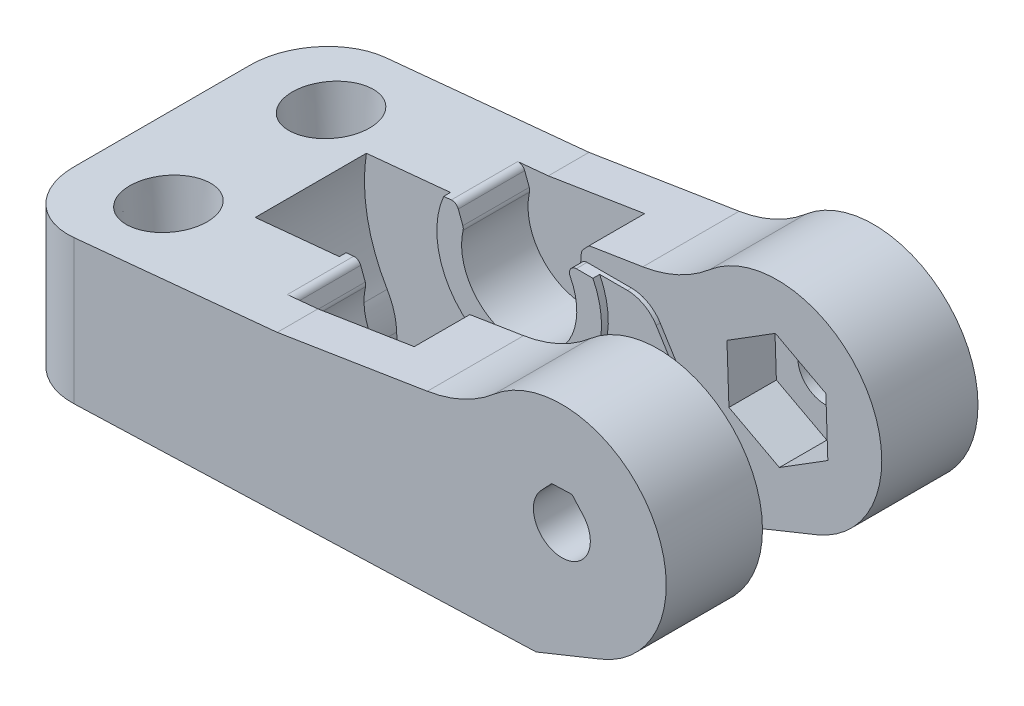
from build123d import *
from build123d.topology import SkipClean

# Parameters (mm, degrees)
SALIENTE_EXTRUIR1_DEPTH         = 23
CORTAR_EXTRUIR1_DEPTH           = 4.4
CROQUIS4_R                      = 2.1
CORTAR_EXTRUIR3_DEPTH           = 49.155331227
CORTAR_EXTRUIR11_DEPTH          = 49.155331227
CROQUIS5_R                      = 11.915
CORTAR_EXTRUIR4_DEPTH           = 4.1
SALIENTE_EXTRUIR2_DEPTH         = 0.5
CROQUIS7_R                      = 4.25
CORTAR_EXTRUIR5_DEPTH           = 6.25
CORTAR_EXTRUIR7_DEPTH           = 3.5
CROQUIS10_R                     = 2.25
CORTAR_EXTRUIR8_DEPTH           = 53.746474455
CORTAR_EXTRUIR8_DRAFT           = -3
CORTAR_EXTRUIR8_PROFILE_2_DEPTH = 53.746474455
CORTAR_EXTRUIR8_PROFILE_2_DRAFT = -3
REDONDEO1_R                     = 5
REDONDEO2_R                     = 2.5
REDONDEO7_R                     = 5
REDONDEO11_R                    = 1
CORTAR_EXTRUIR13_DEPTH          = 8.8
REDONDEO12_R                    = 3
CORTAR_EXTRUIR14_DEPTH          = 8.2
REDONDEO13_R                    = 5
MOVER_CARA1_BY                  = 0.1
MOVER_CARA1_2_BY                = 0.1
MOVER_CARA1_3_BY                = 0.1
MOVER_CARA1_4_BY                = 0.1
CORTAR_EXTRUIR16_DEPTH          = 8.5
CORTAR_EXTRUIR21_DEPTH          = 49.155331227
REDONDEO18_R                    = 3
CORTAR_EXTRUIR24_DEPTH          = 49.155331227
SALIENTE_EXTRUIR10_DEPTH        = 7.1
CROQUIS40_W                     = 6.032148686
CROQUIS40_H                     = 4.1
CORTAR_EXTRUIR25_DEPTH          = 10
REDONDEO21_R                    = 10
CORTAR_EXTRUIR27_DEPTH          = 4.9
CORTAR_EXTRUIR28_DEPTH          = 0.8
CORTAR_EXTRUIR29_DEPTH          = 4.1
REDONDEO21_OF_SIMETR_A4_R       = 10
REDONDEO22_R                    = 0.5
REDONDEO23_R                    = 0.5


with BuildPart() as part:
    # Croquis1 → Saliente-Extruir1 (new body)
    with BuildSketch(Plane.XY):
        with BuildLine():
            Line((1.026246547, -8.96964858), (-41, -10.437237448))
            Line((-41, -10.437237448), (-41, 1.8))
            Line((-41, 1.8), (-7.486654794, 1.8))
            ThreePointArc((-7.486654794, 1.8), (4.166571915, 6.475313002), (4.74059336, -6.067682803))
            Line((4.74059336, -6.067682803), (1.026246547, -8.96964858))
        make_face()
    extrude(amount=SALIENTE_EXTRUIR1_DEPTH)

    # Croquis2 → Cortar-Extruir1 (cut, symmetric)
    with BuildSketch(Plane.XY.offset(11.5)):
        with BuildLine():
            Line((-5.936336673, -3.70943485), (-9.720717172, 2.346839933))
            ThreePointArc((-9.720717172, 2.346839933), (7.132504492, 7.009092643), (2.176832591, -9.760194664))
            Line((2.176832591, -9.760194664), (-3.812473245, -5.870693976))
            ThreePointArc((-3.812473245, -5.870693976), (-4.992753144, -4.90636485), (-5.936336673, -3.70943485))
        make_face()
    extrude(amount=CORTAR_EXTRUIR1_DEPTH, both=True, mode=Mode.SUBTRACT)

    # Croquis4 → Cortar-Extruir3 (cut, through all)
    with BuildSketch(Plane.XY.offset(23)):
        Circle(CROQUIS4_R)
    extrude(amount=-CORTAR_EXTRUIR3_DEPTH, mode=Mode.SUBTRACT)

    # Croquis15 → Cortar-Extruir11 (cut, through all)
    with BuildSketch(Plane.XY.offset(23)):
        with BuildLine():
            Line((-1.526902065, 1.441724691), (-0.74954312, 2.265010153))
            Line((-0.74954312, 2.265010153), (0.74954312, 2.317359398))
            Line((0.74954312, 2.317359398), (1.569316776, 1.395437156))
            ThreePointArc((1.569316776, 1.395437156), (0.031390857, 2.099765371), (-1.526902065, 1.441724691))
        make_face()
    extrude(amount=-CORTAR_EXTRUIR11_DEPTH, mode=Mode.SUBTRACT)

    # Croquis5 → Cortar-Extruir4 (cut, symmetric)
    with BuildSketch(Plane.XY.offset(11.5)):
        with Locations((-18.25, -0.9)):
            Circle(CROQUIS5_R)
    extrude(amount=CORTAR_EXTRUIR4_DEPTH, both=True, mode=Mode.SUBTRACT)

    # Croquis6 → Saliente-Extruir2 (add)
    with BuildSketch(Plane(origin=(0, 0, 15.6), x_dir=(-1, 0, 0), z_dir=(0, 0, -1))):
        with BuildLine():
            Line((12.80797602, 1.8), (14.967851314, 1.8))
            ThreePointArc((14.967851314, 1.8), (18.25, -5.15), (21.532148686, 1.8))
            Line((21.532148686, 1.8), (23.69202398, 1.8))
            ThreePointArc((23.69202398, 1.8), (18.25, -6.975), (12.80797602, 1.8))
        make_face()
    saliente_extruir2 = extrude(amount=SALIENTE_EXTRUIR2_DEPTH)

    # Croquis7 → Cortar-Extruir5 (cut, symmetric)
    with SkipClean():  # the faces are left unmerged after this step: merging them gives an invalid solid
        with BuildSketch(Plane(origin=(0, 0, 11.5), x_dir=(-1, 0, 0), z_dir=(0, 0, -1))):
            with Locations((18.25, -0.9)):
                Circle(CROQUIS7_R)
        cortar_extruir5 = extrude(amount=CORTAR_EXTRUIR5_DEPTH, both=True, mode=Mode.SUBTRACT)
    add(part.part.scale(1), mode=Mode.REPLACE)  # the faces are merged on a copy

    # Croquis9 → Cortar-Extruir7 (cut)
    with BuildSketch(Plane(origin=(0, 0, 15.9), x_dir=(-1, 0, 0), z_dir=(0, 0, -1))):
        Polygon((-3.574231815, 2.233427918), (-3.721321222, -1.978661592), (-0.147089407, -4.21208951), (3.574231815, -2.233427918), (3.721321222, 1.978661592), (0.147089407, 4.21208951), align=None)
    cortar_extruir7 = extrude(amount=-CORTAR_EXTRUIR7_DEPTH, mode=Mode.SUBTRACT)

    # Simetría2: Saliente-Extruir2, Cortar-Extruir5, Cortar-Extruir7 across plane
    with SkipClean():  # the faces are left unmerged after this step: merging them gives an invalid solid
        add(saliente_extruir2.mirror(Plane.XY.offset(11.5)))
        add(cortar_extruir5.mirror(Plane.XY.offset(11.5)), mode=Mode.SUBTRACT)
        add(cortar_extruir7.mirror(Plane.XY.offset(11.5)), mode=Mode.SUBTRACT)
    add(part.part.scale(1), mode=Mode.REPLACE)  # the faces are merged on a copy


with BuildPart() as cortar_extruir8_tool:
    # Croquis10 → Cortar-Extruir8 (with draft: the straight prism first)
    with BuildSketch(Plane(origin=(1.359936523, -9.958605413, -3), x_dir=(-0.999390827019096, -0.034899496702497465, 0), z_dir=(-0.034899496702497465, 0.999390827019096, 0))):
        with Locations((35.51155777, 8.5)):
            Circle(CROQUIS10_R)
    extrude(amount=CORTAR_EXTRUIR8_DEPTH)
    # Cortar-Extruir8: the draft: its side faces are tilted about the plane it starts from
    cortar_extruir8_sides = [cortar_extruir8_tool.faces().sort_by_distance(p)[0] for p in [
        (-32.819221658, 15.737449738, 5.5),
    ]]
    draft(cortar_extruir8_sides, Plane(origin=(1.359936523, -9.958605413, -3), x_dir=(-0.999390827019096, -0.034899496702497465, 0), z_dir=(-0.034899496702497465, 0.999390827019096, 0)), CORTAR_EXTRUIR8_DRAFT)


with BuildPart() as part_1:
    add(part.part)

    # Cortar-Extruir8: cut by cortar_extruir8_tool
    add(cortar_extruir8_tool.part, mode=Mode.SUBTRACT)


with BuildPart() as cortar_extruir8_profile_2_tool:
    # Croquis10 → Cortar-Extruir8 profile 2 (with draft: the straight prism first)
    with BuildSketch(Plane(origin=(1.359936523, -9.958605413, -3), x_dir=(-0.999390827019096, -0.034899496702497465, 0), z_dir=(-0.034899496702497465, 0.999390827019096, 0))):
        with Locations((35.51155777, 20.5)):
            Circle(CROQUIS10_R)
    extrude(amount=CORTAR_EXTRUIR8_PROFILE_2_DEPTH)
    # Cortar-Extruir8 profile 2: the draft: its side faces are tilted about the plane it starts from
    cortar_extruir8_profile_2_sides = [cortar_extruir8_profile_2_tool.faces().sort_by_distance(p)[0] for p in [
        (-32.819221658, 15.737449738, 17.5),
    ]]
    draft(cortar_extruir8_profile_2_sides, Plane(origin=(1.359936523, -9.958605413, -3), x_dir=(-0.999390827019096, -0.034899496702497465, 0), z_dir=(-0.034899496702497465, 0.999390827019096, 0)), CORTAR_EXTRUIR8_PROFILE_2_DRAFT)


with BuildPart() as part_2:
    add(part_1.part)

    # Cortar-Extruir8 profile 2: cut by cortar_extruir8_profile_2_tool
    add(cortar_extruir8_profile_2_tool.part, mode=Mode.SUBTRACT)

    # Redondeo1
    redondeo1_edges = [part_2.edges().sort_by_distance(p)[0] for p in [
        (-7.486654794, 1.8, 3.55),
        (-7.486654794, 1.8, 19.45),
    ]]
    fillet(redondeo1_edges, radius=REDONDEO1_R)

    # Redondeo2
    # the kernel refuses this fillet: 2.5 mm, written as the material it takes off along each edge
    with BuildSketch(Plane(origin=(-9.477934737, 1.95830682, 11.66888847), x_dir=(-0.9925180140171804, -0.12209828766773127, 0), z_dir=(0, 0, 1)), Plane(origin=(-9.477934737, 1.95830682, 7.1), x_dir=(-0.9925180140171804, -0.12209828766773127, 0), z_dir=(0, 0, 1))) as redondeo2_piece_1:
        with BuildLine():
            CenterArc((1.601798054, 2.481295035), REDONDEO2_R, 204.986783762, 58)
            Line((-0.664215063, 1.425272047), (-0.890816375, 1.319669748))
            Line((-0.890816375, 1.319669748), (-0.226601312, -0.105602299))
            Line((-0.226601312, -0.105602299), (0.032385005, -0.247893549))
            ThreePointArc((0.032385005, -0.247893549), (1.22766696, -0.243410407), (1.266027763, -0.248129504))
            Line((1.266027763, -0.248129504), (1.296552335, 0))
        make_face()
    extrude(amount=4.23111153, mode=Mode.SUBTRACT)

    # Redondeo7
    redondeo7_edges = [part_2.edges().sort_by_distance(p)[0] for p in [
        (-41, -4.318618724, 23),
        (-41, -4.318618724, 0),
    ]]
    fillet(redondeo7_edges, radius=REDONDEO7_R)

    # Redondeo11
    # the kernel refuses this fillet: 1 mm, written as the material it takes off along each edge
    with BuildSketch(Plane(origin=(-6.491004214, -2.821781232, 7.4), x_dir=(-0.24834471641059566, -0.9686717203629621, 0), z_dir=(0, 0, 1))) as redondeo11_piece_1:
        with BuildLine():
            CenterArc((2.206273853, 0.996044557), REDONDEO11_R, 144.980572928, 119.921677826)
            Line((1.387316336, 1.569898707), (1.305420584, 1.627284122))
            ThreePointArc((1.305420584, 1.627284122), (0.649703597, 0.826722603), (-0.072392607, 0.068987756))
            Line((-0.072392607, 0.068987756), (0.008885517, -0.099604456))
            ThreePointArc((0.008885517, -0.099604456), (1.058709342, -0.052870893), (2.108533166, -0.099604456))
            Line((2.108533166, -0.099604456), (2.117418683, 0))
        make_face()
    extrude(amount=8.2, mode=Mode.SUBTRACT)

    # Croquis18 → Cortar-Extruir13 (cut)
    with SkipClean():  # the faces are left unmerged after this step: merging them gives an invalid solid
        with BuildSketch(Plane(origin=(0, 0, 15.9), x_dir=(-1, 0, 0), z_dir=(0, 0, -1))):
            Polygon((1.963233069, -7.071604588), (-0.962904484, -8.971860533), (1.89339153, -9.071604588), align=None)
        extrude(amount=CORTAR_EXTRUIR13_DEPTH, mode=Mode.SUBTRACT)

    # Redondeo12
    redondeo12_edges = [part_2.edges().sort_by_distance(p)[0] for p in [
        (-1.963233069, -7.071604588, 11.5),
    ]]
    fillet(redondeo12_edges, radius=REDONDEO12_R)

    # Croquis19 → Cortar-Extruir14 (cut)
    with BuildSketch(Plane(origin=(0, 0, 15.6), x_dir=(-1, 0, 0), z_dir=(0, 0, -1))):
        with BuildLine():
            Line((7.507784355, -9.267663506), (7.612546663, -6.267663506))
            ThreePointArc((7.612546663, -6.267663506), (8.606937748, -7.898469504), (9.849140871, -9.349425477))
            Line((9.849140871, -9.349425477), (7.507784355, -9.267663506))
        make_face()
        with BuildLine():
            Line((27.83695426, -7.975134841), (27.767112721, -9.975134841))
            Line((27.767112721, -9.975134841), (26.040992932, -9.91485741))
            ThreePointArc((26.040992932, -9.91485741), (26.992933893, -8.994957192), (27.83695426, -7.975134841))
        make_face()
    extrude(amount=CORTAR_EXTRUIR14_DEPTH, mode=Mode.SUBTRACT)

    # Redondeo13
    redondeo13_edges = [part_2.edges().sort_by_distance(p)[0] for p in [
        (-7.612546663, -6.267663506, 11.5),
        (-27.83695426, -7.975134841, 11.5),
    ]]
    fillet(redondeo13_edges, radius=REDONDEO13_R)

    # Mover cara1: a face moved outward by 0.1
    extrude(part_2.faces().sort_by_distance((1.159429948, 1.856398277, 1.8))[0], amount=MOVER_CARA1_BY, dir=(-0.747293703, -0.664493884, 0))

    # Mover cara1 2: a face moved outward by 0.1
    extrude(part_2.faces().sort_by_distance((0, 2.291184775, 1.8))[0], amount=MOVER_CARA1_2_BY, dir=(0.034899497, -0.999390827, 0))

    # Mover cara1 3: a face moved outward by 0.1
    extrude(part_2.faces().sort_by_distance((-1.138222593, 1.853367422, 1.8))[0], amount=MOVER_CARA1_3_BY, dir=(0.727096222, -0.686535567, 0))

    # Mover cara1 4: a curved face moved outward by 0.1
    add(Solid.thicken(part_2.faces().sort_by_distance((-0.031390857, -2.099765371, 1.8))[0], MOVER_CARA1_4_BY))

    # Croquis27 → Cortar-Extruir16 (cut, symmetric)
    with BuildSketch(Plane.XY.offset(11.5)):
        with BuildLine():
            Line((-14.967851314, 1.8), (-21.532148686, 1.8))
            ThreePointArc((-21.532148686, 1.8), (-18.25, -5.15), (-14.967851314, 1.8))
        make_face()
    extrude(amount=CORTAR_EXTRUIR16_DEPTH, both=True, mode=Mode.SUBTRACT)

    # Croquis35 → Cortar-Extruir21 (cut, through all)
    with BuildSketch(Plane.XY.offset(23)):
        with BuildLine():
            Line((-1.89339153, -9.071604588), (2.886919592, -7.138325803))
            ThreePointArc((2.886919592, -7.138325803), (3.85114367, -6.66773518), (4.74059336, -6.067682803))
            Line((4.74059336, -6.067682803), (1.026246547, -8.96964858))
            Line((1.026246547, -8.96964858), (-1.89339153, -9.071604588))
        make_face()
    extrude(amount=-CORTAR_EXTRUIR21_DEPTH, mode=Mode.SUBTRACT)

    # Redondeo18
    # the kernel refuses this fillet: 3 mm, written as the material it takes off along each edge
    with BuildSketch(Plane(origin=(-7.507784355, -9.267663506, 15.6), x_dir=(-0.03489949670249421, 0.999390827019096, 0), z_dir=(0, 0, -1))) as redondeo18_piece_1:
        with BuildLine():
            CenterArc((3, 2.765561458), REDONDEO18_R, 180, 67.198620204)
            Line((0, 2.765561458), (0, 0))
            Line((0, 0), (1.83738664, 0))
        make_face()
    extrude(amount=8.2, mode=Mode.SUBTRACT)

    # Croquis38 → Cortar-Extruir24 (cut, through all)
    with SkipClean():  # the faces are left unmerged after this step: merging them gives an invalid solid
        with BuildSketch(Plane.XY.offset(23)):
            Polygon((-46, -0.607226205), (-21, 1.8), (-46.23178952, 1.8), align=None)
        extrude(amount=-CORTAR_EXTRUIR24_DEPTH, mode=Mode.SUBTRACT)
    add(part_2.part.scale(1), mode=Mode.REPLACE)  # the faces are merged on a copy

    # Croquis39 → Saliente-Extruir10 (add)
    with BuildSketch(Plane.XY.offset(23)):
        with BuildLine():
            Line((-6.503247995, 4.122834646), (-21, 1.8))
            Line((-21, 1.8), (-10.726136303, 1.8))
            ThreePointArc((-10.726136303, 1.8), (-8.316346559, 2.41902826), (-6.503247995, 4.122834646))
        make_face()
    saliente_extruir10 = extrude(amount=-SALIENTE_EXTRUIR10_DEPTH)

    # Croquis40 → Cortar-Extruir25 (cut, along a direction that is not the sketch's normal)
    with BuildSketch(Plane.XZ.offset(-1.8)):
        with Locations((-17.983925657, 17.95)):
            Rectangle(CROQUIS40_W, CROQUIS40_H)
    cortar_extruir25 = extrude(amount=-CORTAR_EXTRUIR25_DEPTH, dir=(-0.686535566929956, -0.727096221514157, 0), mode=Mode.SUBTRACT)

    # Redondeo21
    # the kernel refuses this fillet: 10 mm, written as the material it adds along each edge
    with BuildSketch(Plane(origin=(-6.503247995, 4.122834646, 15.9), x_dir=(-0.987404963998654, -0.15821326452234308, 0), z_dir=(0, 0, 1))) as redondeo21_piece_1:
        with BuildLine():
            CenterArc((3.465979652, -10), REDONDEO21_R, 90, 31.449927224)
            ThreePointArc((-1.751552481, -1.469035316), (-0.82095501, -0.79988182), (0, 0))
            Line((0, 0), (3.465979652, 0))
        make_face()
    extrude(amount=7.1)

    # Croquis42 → Cortar-Extruir27 (cut)
    with SkipClean():  # the faces are left unmerged after this step: merging them gives an invalid solid
        with BuildSketch(Plane(origin=(0, 0, 15.1), x_dir=(-1, 0, 0), z_dir=(0, 0, -1))):
            with BuildLine():
                Line((22.877081636, 1.619257596), (22.351285679, 0.214430699))
                ThreePointArc((22.351285679, 0.214430699), (22.042148108, 1.018883197), (21.577081636, 1.744433359))
                Line((21.577081636, 1.744433359), (22.877081636, 1.619257596))
            make_face()
        cortar_extruir27 = extrude(amount=-CORTAR_EXTRUIR27_DEPTH, mode=Mode.SUBTRACT)

    # Croquis43 → Cortar-Extruir28 (cut)
    with SkipClean():  # the faces are left unmerged after this step: merging them gives an invalid solid
        with BuildSketch(Plane(origin=(0, 0, 15.1), x_dir=(-1, 0, 0), z_dir=(0, 0, -1))):
            with BuildLine():
                Line((14.967851314, 1.8), (14.040190028, 1.8))
                ThreePointArc((14.040190028, 1.8), (14.46785197, 1.559046836), (14.48332792, 1.068421053))
                ThreePointArc((14.48332792, 1.068421053), (14.706658288, 1.446748711), (14.967851314, 1.8))
            make_face()
        cortar_extruir28 = extrude(amount=-CORTAR_EXTRUIR28_DEPTH, mode=Mode.SUBTRACT)

    # Croquis44 → Cortar-Extruir29 (cut)
    with SkipClean():  # the faces are left unmerged after this step: merging them gives an invalid solid
        with BuildSketch(Plane(origin=(0, 0, 15.9), x_dir=(-1, 0, 0), z_dir=(0, 0, -1))):
            with BuildLine():
                Line((14.452949638, 2.345322166), (14.967851314, 1.8))
                ThreePointArc((14.967851314, 1.8), (14.740019054, 1.496358438), (14.540190028, 1.173598315))
                Line((14.540190028, 1.173598315), (14.452949638, 2.345322166))
            make_face()
        cortar_extruir29 = extrude(amount=-CORTAR_EXTRUIR29_DEPTH, mode=Mode.SUBTRACT)

    # Simetría4: Saliente-Extruir10, Cortar-Extruir25, Cortar-Extruir27, Cortar-Extruir28, Cortar-Extruir29 across plane
    with SkipClean():  # the faces are left unmerged after this step: merging them gives an invalid solid
        add(saliente_extruir10.mirror(Plane.XY.offset(11.5)))
        add(cortar_extruir25.mirror(Plane.XY.offset(11.5)), mode=Mode.SUBTRACT)
        add(cortar_extruir27.mirror(Plane.XY.offset(11.5)), mode=Mode.SUBTRACT)
        add(cortar_extruir28.mirror(Plane.XY.offset(11.5)), mode=Mode.SUBTRACT)
        add(cortar_extruir29.mirror(Plane.XY.offset(11.5)), mode=Mode.SUBTRACT)

    # Redondeo21 of Simetría4
    # the kernel refuses this fillet: 10 mm, written as the material it adds along each edge
    with BuildSketch(Plane(origin=(-6.503247995, 4.122834646, 0), x_dir=(-0.987404963998654, -0.15821326452234308, 0), z_dir=(0, 0, 1))) as redondeo21_of_simetr_a4_piece_1:
        with BuildLine():
            CenterArc((3.465979652, -10), REDONDEO21_OF_SIMETR_A4_R, 90, 31.449927224)
            ThreePointArc((-1.751552481, -1.469035316), (-0.82095501, -0.79988182), (0, 0))
            Line((0, 0), (3.465979652, 0))
        make_face()
    extrude(amount=7.1)

    # Redondeo22
    redondeo22_edges = [part_2.edges().sort_by_distance(p)[0] for p in [
        (-22.351285679, 0.214430699, 16.675),
        (-22.877081636, 1.619257596, 17.55),
        (-22.351285679, 0.214430699, 5.45),
        (-22.877081636, 1.619257596, 5.45),
    ]]
    fillet(redondeo22_edges, radius=REDONDEO22_R)

    # Redondeo23
    # the kernel refuses this fillet: 0.5 mm, written as the material it takes off along each edge
    with BuildSketch(Plane(origin=(-14.452949638, 2.345322166, 15.456143373), x_dir=(0.6865355669299714, 0.7270962215141423, 0), z_dir=(0, 0, 1)), Plane(origin=(-14.452949638, 2.345322166, 7.543856627), x_dir=(-0.07424921960505192, -0.9972397171132128, 0), z_dir=(0, 0, -1))) as redondeo23_piece_1:
        with BuildLine():
            CenterArc((REDONDEO23_R * 0.355085301889, -REDONDEO23_R), REDONDEO23_R, 90, 39.09840529)
            Line((-REDONDEO23_R * 0.27556890564, -REDONDEO23_R * 0.223936039667), (0, 0))
            Line((0, 0), (REDONDEO23_R * 0.355085301889, 0))
        make_face()
    extrude(amount=4.543856627, mode=Mode.SUBTRACT)
    with BuildSketch(Plane(origin=(-14.540190028, 1.173598315, 17.75), x_dir=(0.07424921960503571, 0.9972397171132141, 0), z_dir=(0, 0, 1))) as redondeo23_piece_2:
        with BuildLine():
            CenterArc((0.145764239, -0.5), REDONDEO23_R, 90, 31.602213252)
            ThreePointArc((-0.116245165, -0.074146654), (-0.057821878, -0.037544763), (0, 0))
            Line((0, 0), (0.145764239, 0))
        make_face()
    extrude(amount=2.25, mode=Mode.SUBTRACT)
    with BuildSketch(Plane(origin=(-14.540190028, 1.173598315, 7.464410597), x_dir=(0.07424921960503526, 0.9972397171132141, 0), z_dir=(0, 0, -1))) as redondeo23_piece_3_section:
        with BuildLine():
            CenterArc((0.145764239, 0.5), REDONDEO23_R, 238.397786748, 31.602213252)
            ThreePointArc((-0.116245165, 0.074146654), (-0.057821878, 0.037544763), (0, 0))
            Line((0, 0), (0.145764239, 0))
        make_face()
    redondeo23_piece_3 = extrude(amount=4.464410597, mode=Mode.PRIVATE)
    redondeo23_piece_3 = redondeo23_piece_3 - Plane(origin=(-14.040190028, 1.3, 7.464410597), x_dir=(0, 1, 0), z_dir=(0, 0, 1)) * Cylinder(0.5, 10, mode=Mode.PRIVATE)
    add(redondeo23_piece_3, mode=Mode.SUBTRACT)
    with BuildSketch(Plane(origin=(-14.540190028, 1.173598315, 7.1), x_dir=(0.07424921960503526, 0.9972397171132141, 0), z_dir=(0, 0, -1))) as redondeo23_piece_4:
        with BuildLine():
            CenterArc((0.145764239, 0.5), REDONDEO23_R, 238.397786748, 31.602213252)
            ThreePointArc((-0.116245165, 0.074146654), (-0.057821878, 0.037544763), (0, 0))
            Line((0, 0), (0.145764239, 0))
        make_face()
    extrude(amount=4.1, mode=Mode.SUBTRACT)
    with BuildSketch(Plane(origin=(-14.540190028, 1.173598315, 15.535589403), x_dir=(0.07424921960503526, 0.9972397171132141, 0), z_dir=(0, 0, 1))) as redondeo23_piece_5_section:
        with BuildLine():
            CenterArc((0.145764239, -0.5), REDONDEO23_R, 90, 31.602213252)
            ThreePointArc((-0.116245165, -0.074146654), (-0.057821878, -0.037544763), (0, 0))
            Line((0, 0), (0.145764239, 0))
        make_face()
    redondeo23_piece_5 = extrude(amount=2.214410597, mode=Mode.PRIVATE)
    redondeo23_piece_5 = redondeo23_piece_5 - Plane(origin=(-14.040190028, 1.3, 15.535589403), x_dir=(0, 1, 0), z_dir=(0, 0, -1)) * Cylinder(0.5, 6, mode=Mode.PRIVATE)
    add(redondeo23_piece_5, mode=Mode.SUBTRACT)
    with BuildSketch(Plane(origin=(-14.540190028, 1.173598315, 15.9), x_dir=(0.07424921960503526, 0.9972397171132141, 0), z_dir=(0, 0, 1))) as redondeo23_piece_6:
        with BuildLine():
            CenterArc((0.145764239, -0.5), REDONDEO23_R, 90, 31.602213252)
            ThreePointArc((-0.116245165, -0.074146654), (-0.057821878, -0.037544763), (0, 0))
            Line((0, 0), (0.145764239, 0))
        make_face()
    extrude(amount=1.85, mode=Mode.SUBTRACT)


solid = part_2.part
